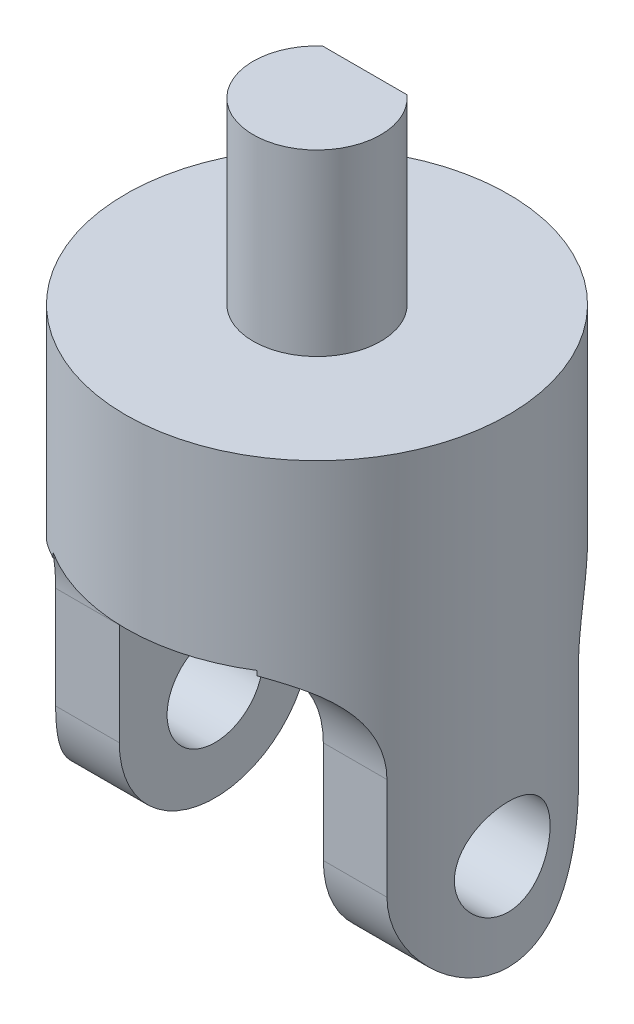
from build123d import *

# Parameters (mm, degrees)
IZIM2_R                          = 19.05
Y_KSEKLIK_EKSTR_ZYON2_DEPTH      = 18.42
Y_KSEKLIK_EKSTR_ZYON4_REACH      = 41.439
Y_KSEKLIK_EKSTR_ZYON4_END_RADIUS = 19.05
IZIM3_R                          = 4.765
RADYUS1_R                        = 9.53
IZIM5_R                          = 6.35
Y_KSEKLIK_EKSTR_ZYON5_DEPTH      = 17.81
IZIM6_W                          = 1.59
IZIM6_H                          = 11.43
KES_EKSTR_ZYON2_DEPTH            = 8.905


with BuildPart() as part:
    # Çizim2 → Yükseklik-Ekstrüzyon2 (new body)
    with BuildSketch(Plane(origin=(0, 0, 0), x_dir=(1, 0, 0), z_dir=(0, 1, 0))):
        with Locations(Location((0, 0, 0), (0, 0, 270))):
            Circle(IZIM2_R)
    extrude(amount=-Y_KSEKLIK_EKSTR_ZYON2_DEPTH)

    # Yükseklik-Ekstrüzyon4: up to this cylinder (the profile starts inside it)
    y_kseklik_ekstr_zyon4_end = Plane(origin=(0, -31.124737, 0), z_dir=(0, 1, 0)) * Cylinder(Y_KSEKLIK_EKSTR_ZYON4_END_RADIUS, 121.978, mode=Mode.PRIVATE)
    # Çizim3 → Yükseklik-Ekstrüzyon4 (add, up to the surface)
    with BuildSketch(Plane(origin=(10.16, 0, 0), x_dir=(0, 0, -1), z_dir=(1, 0, 0)), mode=Mode.PRIVATE) as y_kseklik_ekstr_zyon4_sk1:
        with BuildLine():
            Line((-9.53, -38.1), (-9.53, -18.42))
            Line((-9.53, -18.42), (9.53, -18.42))
            Line((9.53, -18.42), (9.53, -38.1))
            ThreePointArc((9.53, -38.1), (0, -47.63), (-9.53, -38.1))
        make_face()
        with Locations(Location((0, -38.1, 0), (0, 0, 180))):
            Circle(IZIM3_R, mode=Mode.SUBTRACT)
    y_kseklik_ekstr_zyon4_tool1 = extrude(y_kseklik_ekstr_zyon4_sk1.sketch, amount=Y_KSEKLIK_EKSTR_ZYON4_REACH, mode=Mode.PRIVATE) & y_kseklik_ekstr_zyon4_end
    y_kseklik_ekstr_zyon4 = y_kseklik_ekstr_zyon4_tool1.solids().sort_by_distance((10.16, -31.124737, 0))[0]
    add(y_kseklik_ekstr_zyon4)

    # Aynalama3: Yükseklik-Ekstrüzyon4 across plane
    add(y_kseklik_ekstr_zyon4.mirror(Plane(origin=(0, 0, 0), x_dir=(0, 0, 1), z_dir=(1, 0, 0))))

    # Radyus1
    # the kernel refuses this fillet: 9.53 mm, written as the material it adds along each edge
    with BuildSketch(Plane(origin=(13.665, -18.42, 9.53), x_dir=(0, 0, 1), z_dir=(-1, 0, 0))) as radyus1_piece_1_section:
        with BuildLine():
            CenterArc((RADYUS1_R, -RADYUS1_R), RADYUS1_R, 90, 90)
            Line((0, -RADYUS1_R), (0, 0))
            Line((0, 0), (RADYUS1_R, 0))
        make_face()
    radyus1_piece_1 = extrude(amount=53.98489618, mode=Mode.PRIVATE)
    radyus1_piece_1 = radyus1_piece_1 & Plane(origin=(0, -20.798311962, 0), x_dir=(0, 0, 1), z_dir=(0, 1, 0)) * Cylinder(19.05, 147, mode=Mode.PRIVATE)
    radyus1_piece_1 = split(radyus1_piece_1, bisect_by=Plane(origin=(10.16, -20.798311962, 11.199892809), z_dir=(1, 0, 0)), keep=Keep.TOP, mode=Mode.PRIVATE)
    add(radyus1_piece_1)
    with BuildSketch(Plane(origin=(-10.16, -18.42, 9.53), x_dir=(0, 0, 1), z_dir=(-1, 0, 0))) as radyus1_piece_2_section:
        with BuildLine():
            CenterArc((RADYUS1_R, -RADYUS1_R), RADYUS1_R, 90, 90)
            Line((0, -RADYUS1_R), (0, 0))
            Line((0, 0), (RADYUS1_R, 0))
        make_face()
    radyus1_piece_2 = extrude(amount=30.15989618, mode=Mode.PRIVATE)
    radyus1_piece_2 = radyus1_piece_2 & Plane(origin=(0, -21.011864307, 0), x_dir=(0, 0, 1), z_dir=(0, 1, 0)) * Cylinder(19.05, 99, mode=Mode.PRIVATE)
    add(radyus1_piece_2)
    with BuildSketch(Plane(origin=(13.665, -18.42, -9.53), x_dir=(0, 0, -1), z_dir=(-1, 0, 0))) as radyus1_piece_3_section:
        with BuildLine():
            CenterArc((RADYUS1_R, RADYUS1_R), RADYUS1_R, 180, 90)
            Line((0, RADYUS1_R), (0, 0))
            Line((0, 0), (RADYUS1_R, 0))
        make_face()
    radyus1_piece_3 = extrude(amount=53.98489618, mode=Mode.PRIVATE)
    radyus1_piece_3 = radyus1_piece_3 & Plane(origin=(0, -20.798311941, 0), x_dir=(0, 0, 1), z_dir=(0, 1, 0)) * Cylinder(19.05, 147, mode=Mode.PRIVATE)
    radyus1_piece_3 = split(radyus1_piece_3, bisect_by=Plane(origin=(10.16, -20.798311941, -11.199892873), z_dir=(1, 0, 0)), keep=Keep.TOP, mode=Mode.PRIVATE)
    add(radyus1_piece_3)
    with BuildSketch(Plane(origin=(-10.16, -18.42, -9.53), x_dir=(0, 0, -1), z_dir=(-1, 0, 0))) as radyus1_piece_4_section:
        with BuildLine():
            CenterArc((RADYUS1_R, RADYUS1_R), RADYUS1_R, 180, 90)
            Line((0, RADYUS1_R), (0, 0))
            Line((0, 0), (RADYUS1_R, 0))
        make_face()
    radyus1_piece_4 = extrude(amount=30.15989618, mode=Mode.PRIVATE)
    radyus1_piece_4 = radyus1_piece_4 & Plane(origin=(0, -21.011867626, 0), x_dir=(0, 0, 1), z_dir=(0, 1, 0)) * Cylinder(19.05, 99, mode=Mode.PRIVATE)
    add(radyus1_piece_4)
    with BuildSketch(Plane(origin=(-13.665, -18.42, 9.53), x_dir=(0, 0, 1), z_dir=(1, 0, 0))) as radyus1_piece_5_section:
        with BuildLine():
            CenterArc((RADYUS1_R, RADYUS1_R), RADYUS1_R, 180, 90)
            Line((0, RADYUS1_R), (0, 0))
            Line((0, 0), (RADYUS1_R, 0))
        make_face()
    radyus1_piece_5 = extrude(amount=53.98489618, mode=Mode.PRIVATE)
    radyus1_piece_5 = radyus1_piece_5 & Plane(origin=(0, -20.798312003, 0), x_dir=(0, 0, 1), z_dir=(0, 1, 0)) * Cylinder(19.05, 147, mode=Mode.PRIVATE)
    radyus1_piece_5 = split(radyus1_piece_5, bisect_by=Plane(origin=(-10.16, -20.798312003, 11.199892685), z_dir=(-1, 0, 0)), keep=Keep.TOP, mode=Mode.PRIVATE)
    add(radyus1_piece_5)
    with BuildSketch(Plane(origin=(10.16, -18.42, 9.53), x_dir=(0, 0, 1), z_dir=(1, 0, 0))) as radyus1_piece_6_section:
        with BuildLine():
            CenterArc((RADYUS1_R, RADYUS1_R), RADYUS1_R, 180, 90)
            Line((0, RADYUS1_R), (0, 0))
            Line((0, 0), (RADYUS1_R, 0))
        make_face()
    radyus1_piece_6 = extrude(amount=30.15989618, mode=Mode.PRIVATE)
    radyus1_piece_6 = radyus1_piece_6 & Plane(origin=(0, -21.011867621, 0), x_dir=(0, 0, 1), z_dir=(0, 1, 0)) * Cylinder(19.05, 99, mode=Mode.PRIVATE)
    add(radyus1_piece_6)
    with BuildSketch(Plane(origin=(-13.665, -18.42, -9.53), x_dir=(0, 0, -1), z_dir=(1, 0, 0))) as radyus1_piece_7_section:
        with BuildLine():
            CenterArc((RADYUS1_R, -RADYUS1_R), RADYUS1_R, 90, 90)
            Line((0, -RADYUS1_R), (0, 0))
            Line((0, 0), (RADYUS1_R, 0))
        make_face()
    radyus1_piece_7 = extrude(amount=53.98489618, mode=Mode.PRIVATE)
    radyus1_piece_7 = radyus1_piece_7 & Plane(origin=(0, -20.798311958, 0), x_dir=(0, 0, 1), z_dir=(0, 1, 0)) * Cylinder(19.05, 147, mode=Mode.PRIVATE)
    radyus1_piece_7 = split(radyus1_piece_7, bisect_by=Plane(origin=(-10.16, -20.798311958, -11.199892821), z_dir=(-1, 0, 0)), keep=Keep.TOP, mode=Mode.PRIVATE)
    add(radyus1_piece_7)
    with BuildSketch(Plane(origin=(10.16, -18.42, -9.53), x_dir=(0, 0, -1), z_dir=(1, 0, 0))) as radyus1_piece_8_section:
        with BuildLine():
            CenterArc((RADYUS1_R, -RADYUS1_R), RADYUS1_R, 90, 90)
            Line((0, -RADYUS1_R), (0, 0))
            Line((0, 0), (RADYUS1_R, 0))
        make_face()
    radyus1_piece_8 = extrude(amount=30.15989618, mode=Mode.PRIVATE)
    radyus1_piece_8 = radyus1_piece_8 & Plane(origin=(0, -21.011864338, 0), x_dir=(0, 0, 1), z_dir=(0, 1, 0)) * Cylinder(19.05, 99, mode=Mode.PRIVATE)
    add(radyus1_piece_8)

    # Çizim5 → Yükseklik-Ekstrüzyon5 (add)
    with BuildSketch(Plane(origin=(0, 0, 0), x_dir=(1, 0, 0), z_dir=(0, 1, 0))):
        with Locations(Location((0, 0, 0), (0, 0, 90))):
            Circle(IZIM5_R)
    extrude(amount=Y_KSEKLIK_EKSTR_ZYON5_DEPTH)

    # Çizim6 → Kes-Ekstrüzyon2 (cut, symmetric)
    with BuildSketch(Plane(origin=(0, 0, 0), x_dir=(0, 0, -1), z_dir=(1, 0, 0))):
        with Locations((5.555, 12.095)):
            Rectangle(IZIM6_W, IZIM6_H)
    extrude(amount=KES_EKSTR_ZYON2_DEPTH, both=True, mode=Mode.SUBTRACT)


solid = part.part
